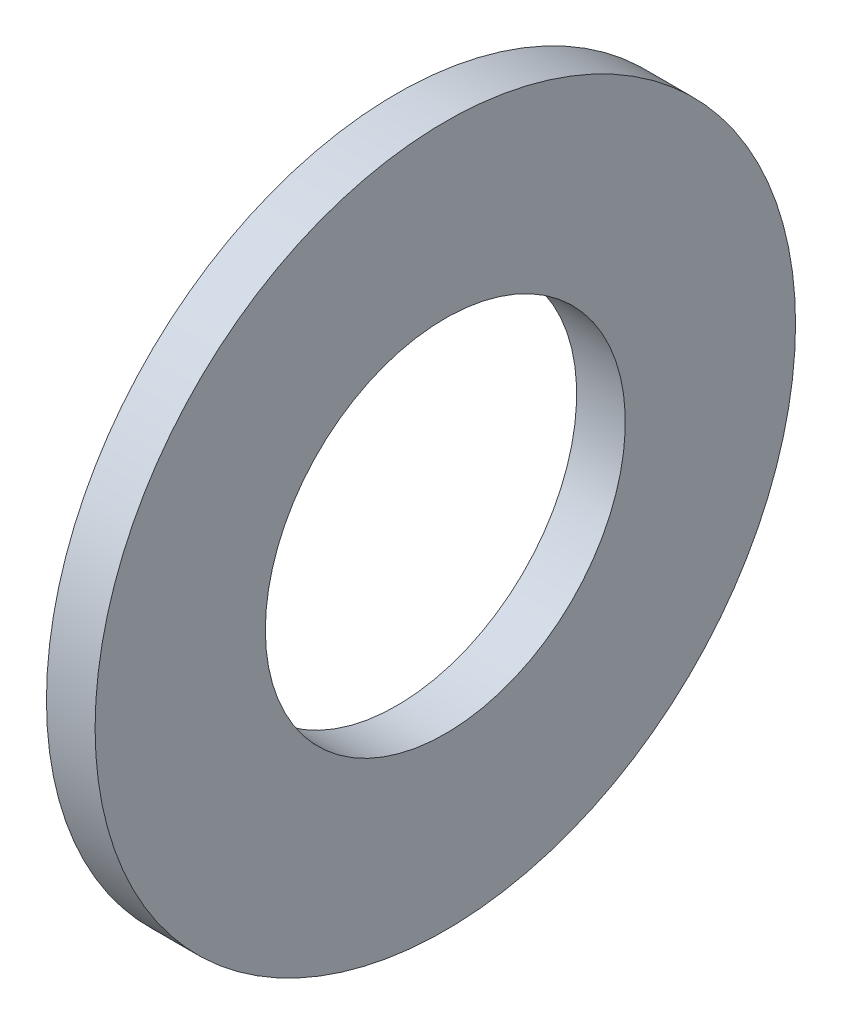
from build123d import *

# Parameters (mm, degrees)
SKETCH1_W = 5
SKETCH1_H = 17.5


with BuildPart() as part:
    # Sketch1 → Base-Revolve (revolve)
    with BuildSketch(Plane.XY):
        with Locations((-2.5, 27.25)):
            Rectangle(SKETCH1_W, SKETCH1_H)
    revolve(axis=Axis((-34.925, 0, 0), (1, 0, 0)))


solid = part.part
